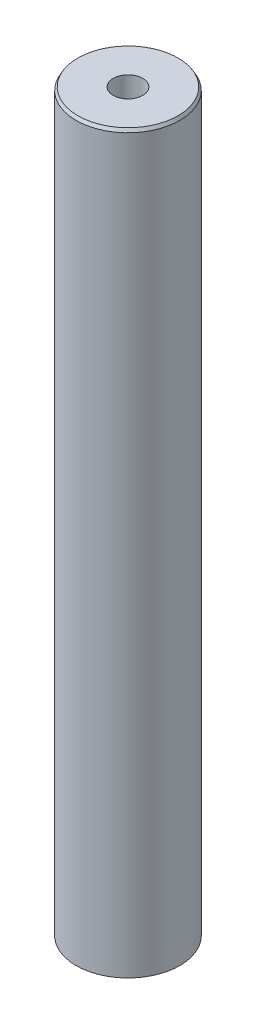
from build123d import *
from OCP.BRepFilletAPI import BRepFilletAPI_MakeChamfer

# Parameters (mm, degrees)
SKETCH1_R           = 40
BOSS_EXTRUDE1_DEPTH = 568.336679964
SKETCH2_R           = 11.416412095
CUT_EXTRUDE1_DEPTH  = 572.144974409
CHAMFER1_SIZE       = 2.398452704
CHAMFER1_SIZE2      = 1.384747314


with BuildPart() as part:
    # Sketch1 → Boss-Extrude1 (new body)
    with BuildSketch(Plane(origin=(0, 0, 0), x_dir=(1, 0, 0), z_dir=(0, 1, 0))):
        Circle(SKETCH1_R)
    extrude(amount=BOSS_EXTRUDE1_DEPTH)

    # Sketch2 → Cut-Extrude1 (cut, through all)
    with BuildSketch(Plane(origin=(0, 0, 0), x_dir=(1, 0, 0), z_dir=(0, 1, 0))):
        Circle(SKETCH2_R)
    extrude(amount=CUT_EXTRUDE1_DEPTH, mode=Mode.SUBTRACT)

    # Chamfer1: one chamfer whose edges measure the first distance from different faces: ONE call of the kernel's chamfer builder (chamfer() names one face for all edges)
    chamfer1_edges_1 = [part.edges().sort_by_distance(p)[0] for p in [
        (-40, 568.336679964, 0),
    ]]
    chamfer1_side_1 = [part.faces().sort_by_distance(p)[0] for p in [
        (-40, 284.168339982, 0),
    ]]
    chamfer1_edges_2 = [part.edges().sort_by_distance(p)[0] for p in [
        (-40, 0, 0),
    ]]
    chamfer1_side_2 = [part.faces().sort_by_distance(p)[0] for p in [
        (-38.86862915, 0, 0),
    ]]
    chamfer1 = BRepFilletAPI_MakeChamfer(part.part.solid().wrapped)
    for e in chamfer1_edges_1:
        chamfer1.Add(CHAMFER1_SIZE, CHAMFER1_SIZE2, e.wrapped, chamfer1_side_1[0].wrapped)  # the first distance lies on this face
    for e in chamfer1_edges_2:
        chamfer1.Add(CHAMFER1_SIZE, CHAMFER1_SIZE2, e.wrapped, chamfer1_side_2[0].wrapped)  # the first distance lies on this face
    add(Compound.cast(chamfer1.Shape()), mode=Mode.REPLACE)


solid = part.part
